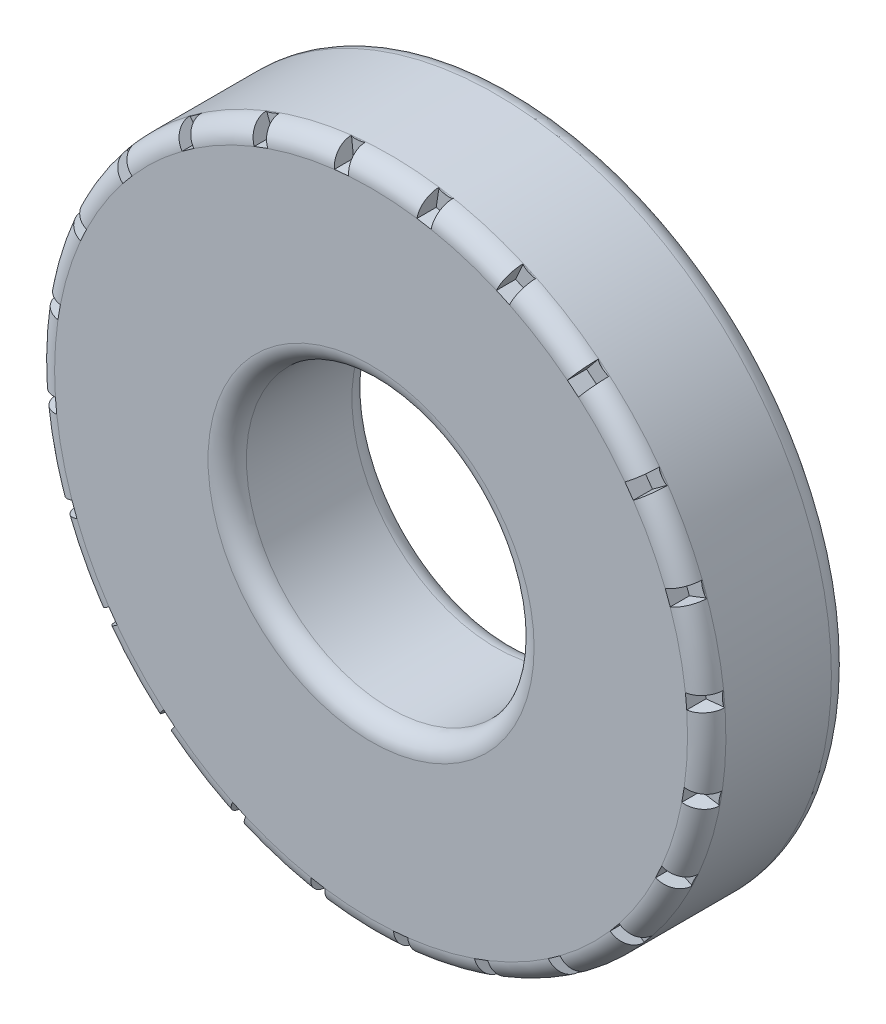
from build123d import *

# Parameters (mm, degrees)
SKETCH_1_R               = 35
EXTRUDE_1_DEPTH          = 15
SKETCH_2_R               = 15
CUT_EXTRUDE_1_DEPTH      = 15
FILLET_1_R               = 2
CUT_EXTRUDE_2_DEPTH      = 2
PATTERN_START            = 13
PATTERN_CIRCULAR_1_DEPTH = 2


# Read off the part's stored shape, not the designer's step: Круговой массив1
with BuildPart() as part:
    # Эскиз1 → Бобышка-Вытянуть1 (new body)
    with BuildSketch(Plane.XY):
        Circle(SKETCH_1_R)
    extrude(amount=EXTRUDE_1_DEPTH)

    # Эскиз2 → Вырез-Вытянуть1 (cut)
    with BuildSketch(Plane.XY.offset(15)):
        Circle(SKETCH_2_R)
    extrude(amount=-CUT_EXTRUDE_1_DEPTH, mode=Mode.SUBTRACT)

    # Скругление1
    fillet_1_edges = [part.edges().sort_by_distance(p)[0] for p in [
        (-35, 0, 0),
        (-35, 0, 15),
        (-15, 0, 0),
        (-15, 0, 15),
    ]]
    fillet(fillet_1_edges, radius=FILLET_1_R)

    # Эскиз3 → Вырез-Вытянуть2 (cut)
    with BuildSketch(Plane.XY.offset(15)):
        Polygon((28.088623374, 20.881313105), (26.472752738, 19.702623238), (27.340747312, 18.479273158), (28.9558798, 19.657439626), align=None)
    extrude(amount=-CUT_EXTRUDE_2_DEPTH, mode=Mode.SUBTRACT)

    # Круговой массив1 outline → Круговой массив1 (cut)
    with BuildSketch(Plane.XY.offset(PATTERN_START)):
        Polygon((21.727045223, 27.439670294), (20.47130143, 25.882925216), (21.626346106, 24.925913306), (22.881512368, 26.481961774), align=None)
        Polygon((13.884804846, 32.1280593), (13.07476476, 30.299348615), (14.438145152, 29.673893654), (15.247807683, 31.50178199), align=None)
        Polygon((5.096337965, 34.626974158), (4.787204479, 32.650921477), (6.266008466, 32.399647188), (6.574990101, 34.374807822), align=None)
        Polygon((-4.039435926, 34.766117951), (-3.826595877, 32.777387998), (-2.333146342, 32.917418309), (-2.54590219, 34.905247309), align=None)
        Polygon((-12.899928935, 32.53600826), (-12.179620047, 30.670129695), (-10.773301082, 31.191921771), (-11.493295454, 33.056951875), align=None)
        Polygon((-20.881313105, 28.088623374), (-19.702623238, 26.472752738), (-18.479273158, 27.340747312), (-19.657439626, 28.9558798), align=None)
        Polygon((-27.439670294, 21.727045223), (-25.882925216, 20.47130143), (-24.925913306, 21.626346106), (-26.481961774, 22.881512368), align=None)
        Polygon((-32.1280593, 13.884804846), (-30.299348615, 13.07476476), (-29.673893654, 14.438145152), (-31.50178199, 15.247807683), align=None)
        Polygon((-34.626974158, 5.096337965), (-32.650921477, 4.787204479), (-32.399647188, 6.266008466), (-34.374807822, 6.574990101), align=None)
        Polygon((-34.766117951, -4.039435926), (-32.777387998, -3.826595877), (-32.917418309, -2.333146342), (-34.905247309, -2.54590219), align=None)
        Polygon((-32.53600826, -12.899928935), (-30.670129695, -12.179620047), (-31.191921771, -10.773301082), (-33.056951875, -11.493295454), align=None)
        Polygon((-28.088623374, -20.881313105), (-26.472752738, -19.702623238), (-27.340747312, -18.479273158), (-28.9558798, -19.657439626), align=None)
        Polygon((-21.727045223, -27.439670294), (-20.47130143, -25.882925216), (-21.626346106, -24.925913306), (-22.881512368, -26.481961774), align=None)
        Polygon((-13.884804846, -32.1280593), (-13.07476476, -30.299348615), (-14.438145152, -29.673893654), (-15.247807683, -31.50178199), align=None)
        Polygon((-5.096337965, -34.626974158), (-4.787204479, -32.650921477), (-6.266008466, -32.399647188), (-6.574990101, -34.374807822), align=None)
        Polygon((4.039435926, -34.766117951), (3.826595877, -32.777387998), (2.333146342, -32.917418309), (2.54590219, -34.905247309), align=None)
        Polygon((12.899928935, -32.53600826), (12.179620047, -30.670129695), (10.773301082, -31.191921771), (11.493295454, -33.056951875), align=None)
        Polygon((20.881313105, -28.088623374), (19.702623238, -26.472752738), (18.479273158, -27.340747312), (19.657439626, -28.9558798), align=None)
        Polygon((27.439670294, -21.727045223), (25.882925216, -20.47130143), (24.925913306, -21.626346106), (26.481961774, -22.881512368), align=None)
        Polygon((32.1280593, -13.884804846), (30.299348615, -13.07476476), (29.673893654, -14.438145152), (31.50178199, -15.247807683), align=None)
        Polygon((34.626974158, -5.096337965), (32.650921477, -4.787204479), (32.399647188, -6.266008466), (34.374807822, -6.574990101), align=None)
        Polygon((34.766117951, 4.039435926), (32.777387998, 3.826595877), (32.917418309, 2.333146342), (34.905247309, 2.54590219), align=None)
        Polygon((32.53600826, 12.899928935), (30.670129695, 12.179620047), (31.191921771, 10.773301082), (33.056951875, 11.493295454), align=None)
    extrude(amount=PATTERN_CIRCULAR_1_DEPTH, mode=Mode.SUBTRACT)


solid = part.part
